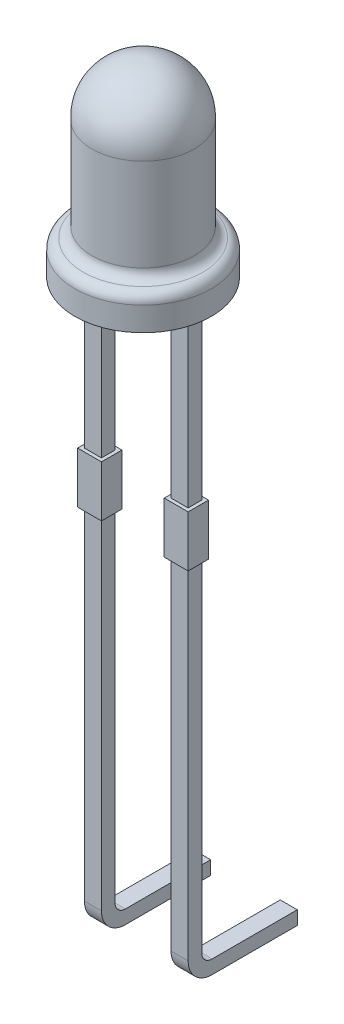
from build123d import *

# Parameters (mm, degrees)
FILLET_1_R      = 0.3
FILLET_2_R      = 0.3
SKETCH_2_W      = 0.5
SKETCH_2_H      = 0.4
EXTRUDE_1_DEPTH = 5
SKETCH_3_W      = 0.7
SKETCH_3_H      = 0.6
EXTRUDE_2_DEPTH = 1.5
SKETCH_5_W      = 0.5
SKETCH_5_H      = 0.4
EXTRUDE_3_DEPTH = 9.5
SWEEP_START     = -1.52
SWEEP_2_DEPTH   = 0.5
SKETCH_7_262_W  = 0.5
SKETCH_7_262_H  = 0.4


# Read off the part's stored shape, not the designer's step: По траектории2
with BuildPart() as part:
    # Эскиз1 → Повернуть2 (revolve)
    with BuildSketch(Plane(origin=(0, 0, 0), x_dir=(0, 0, -1), z_dir=(1, 0, 0))):
        with BuildLine():
            Line((0, 0), (-2, 0))
            Line((-2, 0), (-2, 1))
            Line((-2, 1), (-1.5, 1))
            Line((-1.5, 1), (-1.5, 4))
            ThreePointArc((-1.5, 4), (-1.07971355, 5.07971355), (0, 5.5))
            Line((0, 5.5), (0, 0))
        make_face()
    revolve(axis=Axis((0, 5.5, 0), (0, -1, 0)))

    # Скругление1
    fillet_1_edges = [part.edges().sort_by_distance(p)[0] for p in [
        (0, 1, -2),
    ]]
    fillet(fillet_1_edges, radius=FILLET_1_R)

    # Скругление2
    fillet_2_edges = [part.edges().sort_by_distance(p)[0] for p in [
        (0, 1, -1.5),
    ]]
    fillet(fillet_2_edges, radius=FILLET_2_R)

    # Эскиз2 → Вытянуть1 (add)
    with BuildSketch(Plane.XZ):
        with Locations((-1.27, 0)):
            Rectangle(SKETCH_2_W, SKETCH_2_H)
        with Locations((1.27, 0)):
            Rectangle(SKETCH_2_W, SKETCH_2_H)
    extrude(amount=EXTRUDE_1_DEPTH)

    # Эскиз3 → Вытянуть2 (add)
    with BuildSketch(Plane.XZ.offset(5)):
        with Locations((-1.27, 0)):
            Rectangle(SKETCH_3_W, SKETCH_3_H)
        with Locations((1.27, 0)):
            Rectangle(SKETCH_3_W, SKETCH_3_H)
    extrude(amount=EXTRUDE_2_DEPTH)

    # Эскиз5 → Вытянуть3 (add)
    with BuildSketch(Plane.XZ.offset(6.5)):
        with Locations((-1.27, 0)):
            Rectangle(SKETCH_5_W, SKETCH_5_H)
        with Locations((1.27, 0)):
            Rectangle(SKETCH_5_W, SKETCH_5_H)
    extrude(amount=EXTRUDE_3_DEPTH)

    # По траектории2 outline → По траектории2 (add)
    with BuildSketch(Plane.YZ.offset(SWEEP_START)):
        with BuildLine():
            Line((-17.2, -3), (-16.8, -3))
            Line((-16.8, -3), (-16.8, -0.5))
            ThreePointArc((-16.8, -0.5), (-16.712132034, -0.287867966), (-16.5, -0.2))
            Line((-16.5, -0.2), (-16, -0.2))
            Line((-16, -0.2), (-16, 0.2))
            Line((-16, 0.2), (-16.5, 0.2))
            ThreePointArc((-16.5, 0.2), (-16.994974747, -0.005025253), (-17.2, -0.5))
            Line((-17.2, -0.5), (-17.2, -3))
        make_face()
    extrude(amount=SWEEP_2_DEPTH)

    # По траектории11: sweep along a curve in space
    with BuildLine() as sweep_11_path:
        Line((-1.27, -16, 0), (-1.27, -16.5, 0))
        ThreePointArc((-1.27, -16.5, 0), (-1.27, -16.853553391, -0.146446609), (-1.27, -17, -0.5))
        Line((-1.27, -17, -0.5), (-1.27, -17, -3))
    # Эскиз7<262> → По траектории11 (sweep)
    with BuildSketch(Plane.XZ.offset(16)):
        with Locations((-1.27, 0)):
            Rectangle(SKETCH_7_262_W, SKETCH_7_262_H)
        with Locations((1.27, 0)):
            Rectangle(SKETCH_7_262_W, SKETCH_7_262_H)
    sweep(path=sweep_11_path.line)


solid = part.part
